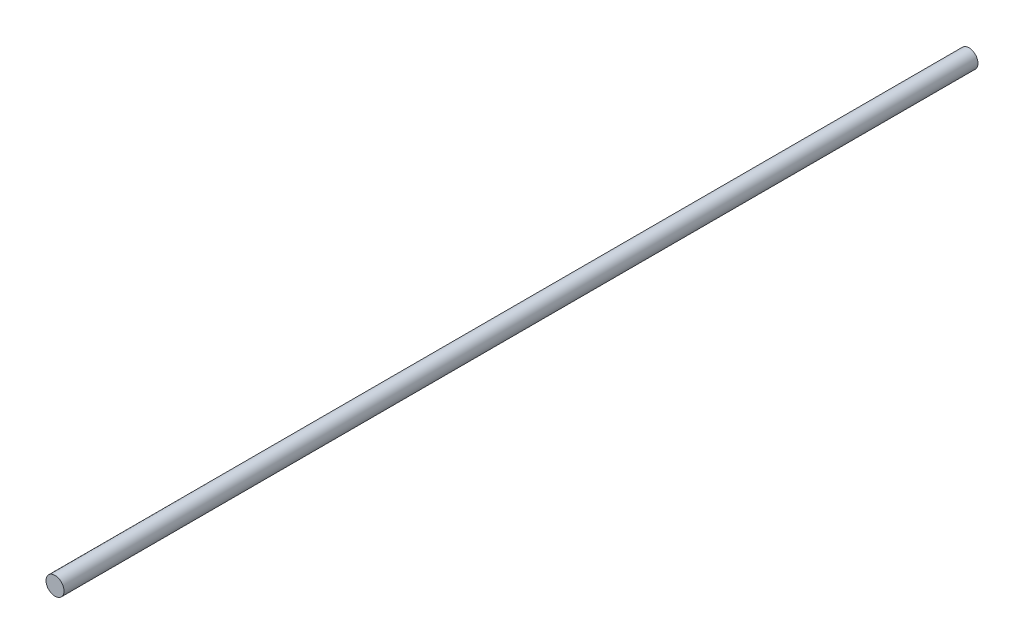
from build123d import *

# Parameters (mm, degrees)
SKETCH2_W = 405
SKETCH2_H = 4


with BuildPart() as part:
    # Sketch2 → Revolve1 (revolve)
    with BuildSketch(Plane(origin=(0, 0, 0), x_dir=(0, 0, -1), z_dir=(1, 0, 0))):
        with Locations((202.5, 2)):
            Rectangle(SKETCH2_W, SKETCH2_H)
    revolve(axis=Axis((0, 0, 0), (0, 0, -1)))


solid = part.part
